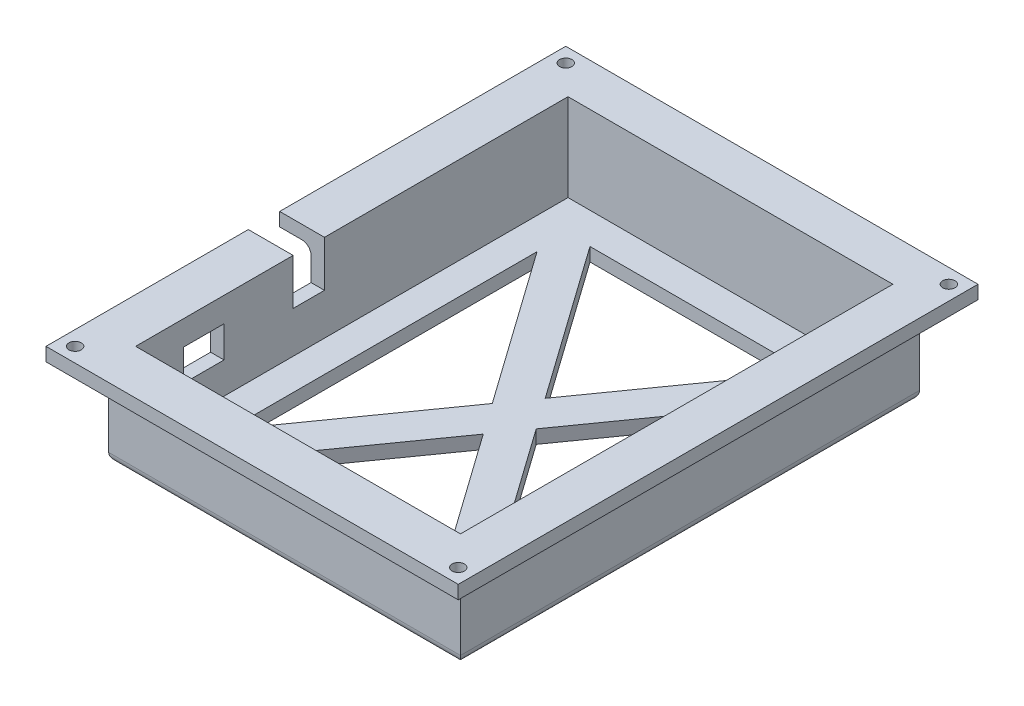
from build123d import *

# Parameters (mm, degrees)
SKETCH1_W              = 72.5
SKETCH1_H              = 96.5
BRACKETBASE_DEPTH      = 3
SKETCH3_W              = 78.5
SKETCH3_H              = 102.5
SKETCH3_W_2            = 72.5
SKETCH3_H_2            = 96.5
BRACKETWALLS_DEPTH     = 22.5
SKETCH4_W              = 7
SKETCH4_H              = 19.5
WIREHOLE_DEPTH         = 22.5
BRACKETFLANGE_DEPTH    = 3
SKETCH7_R              = 1.375
MOUNTINGHOLES_DEPTH    = 136.426179153
SKETCH8_W              = 9
SKETCH8_H              = 7
SWITCHHOLE_DEPTH       = 10
BOSS_EXTRUDE1_REACH    = 112.68
SKETCH10_W             = 2.5
SKETCH10_H             = 7
BOSS_EXTRUDE2_DEPTH    = 12.25
FILLET1_R              = 2
FILLET2_R              = 2
SKETCH11_W             = 7
SKETCH11_H             = 10.25
CUT_EXTRUDE1_DEPTH     = 10
WEIGHTREDUCTION1_DEPTH = 136.890580983


with BuildPart() as part:
    # Sketch1 → bracketBase (new body)
    with BuildSketch(Plane(origin=(0, 0, 0), x_dir=(1, 0, 0), z_dir=(0, 1, 0))):
        with Locations((36.25, 48.25)):
            Rectangle(SKETCH1_W, SKETCH1_H)
    extrude(amount=BRACKETBASE_DEPTH)

    # Sketch3 → bracketWalls (add)
    with BuildSketch(Plane.XZ):
        with Locations((36.25, -48.25)):
            Rectangle(SKETCH3_W, SKETCH3_H)
        with Locations((36.25, -48.25)):
            Rectangle(SKETCH3_W_2, SKETCH3_H_2, mode=Mode.SUBTRACT)
    extrude(amount=-BRACKETWALLS_DEPTH)

    # Sketch4 → wireHole (cut)
    with BuildSketch(Plane.ZY.offset(-72.5)):
        with Locations((-38.65, 12.75)):
            Rectangle(SKETCH4_W, SKETCH4_H)
    wirehole = extrude(amount=-WIREHOLE_DEPTH, mode=Mode.SUBTRACT)

    # Sketch6 → bracketFlange (add)
    with BuildSketch(Plane(origin=(0, 22.5, 0), x_dir=(1, 0, 0), z_dir=(0, 1, 0))):
        Polygon((72.5, 96.5), (72.5, 42.15), (82, 42.15), (82, 106), (-10, 106), (-10, -10), (82, -10), (82, 35.15), (72.5, 35.15), (72.5, 0), (0, 0), (0, 96.5), align=None)
    extrude(amount=-BRACKETFLANGE_DEPTH)

    # Sketch7 → mountingHoles (cut, through all)
    with BuildSketch(Plane.XZ.offset(-19.5)):
        with Locations((78.75, -102.75)):
            Circle(SKETCH7_R)
        with Locations((78.75, 6.75)):
            Circle(SKETCH7_R)
        with Locations((-6.75, -102.75)):
            Circle(SKETCH7_R)
        with Locations((-6.75, 6.75)):
            Circle(SKETCH7_R)
    extrude(amount=-MOUNTINGHOLES_DEPTH, mode=Mode.SUBTRACT)

    # Mirror1: wireHole across plane
    add(wirehole.mirror(Plane(origin=(36, 0, 0), x_dir=(0, 0, 1), z_dir=(1, 0, 0))), mode=Mode.SUBTRACT)

    # Sketch8 → switchHole (cut)
    with BuildSketch(Plane.ZY.offset(3)):
        with Locations((-15.23, 13.5)):
            Rectangle(SKETCH8_W, SKETCH8_H)
    extrude(amount=-SWITCHHOLE_DEPTH, mode=Mode.SUBTRACT)

    # Sketch9 → Boss-Extrude1 (add, up to next)
    with BuildSketch(Plane(origin=(0, 0, -35.15), x_dir=(-1, 0, 0), z_dir=(0, 0, -1)), mode=Mode.PRIVATE) as boss_extrude1_sk1:
        Polygon((-72.5, 3), (-72.5, 22.5), (-82, 22.5), (-82, 19.5), (-75.5, 19.5), (-75.5, 3), align=None)
    boss_extrude1_tool1 = extrude(boss_extrude1_sk1.sketch, amount=BOSS_EXTRUDE1_REACH, mode=Mode.PRIVATE) - part.part
    add(boss_extrude1_tool1.solids().sort_by_distance((75.1875, 14.8125, -35.15))[0])

    # Sketch10 → Boss-Extrude2 (add)
    with BuildSketch(Plane.XZ):
        with Locations((-1.75, -38.65)):
            Rectangle(SKETCH10_W, SKETCH10_H)
    extrude(amount=-BOSS_EXTRUDE2_DEPTH)

    # Fillet1
    fillet1_edges = [part.edges().sort_by_distance(p)[0] for p in [
        (-3, 19.5, -70.825),
        (36.25, 19.5, -99.5),
        (75.5, 19.5, -48.25),
        (36.25, 19.5, 3),
        (-3, 19.5, -16.075),
    ]]
    fillet(fillet1_edges, radius=FILLET1_R)

    # Fillet2
    fillet2_edges = [part.edges().sort_by_distance(p)[0] for p in [
        (36.25, 0, 3),
        (75.5, 0, -48.25),
        (36.25, 0, -99.5),
        (-3, 0, -48.25),
    ]]
    fillet(fillet2_edges, radius=FILLET2_R)

    # Sketch11 → Cut-Extrude1 (cut)
    with BuildSketch(Plane.ZY.offset(0.5)):
        with Locations((-38.65, 17.375)):
            Rectangle(SKETCH11_W, SKETCH11_H)
    extrude(amount=-CUT_EXTRUDE1_DEPTH, mode=Mode.SUBTRACT)

    # Sketch12 → weightReduction1 (cut, through all)
    with BuildSketch(Plane.XZ):
        Polygon((11.903565914, -89.5), (36.25, -55.165285264), (60.596434086, -89.5), align=None)
        Polygon((65.5, -82.584714736), (41.153565914, -48.25), (65.5, -13.915285264), align=None)
        Polygon((60.596434086, -7), (11.903565914, -7), (36.25, -41.334714736), align=None)
        Polygon((7, -13.915285264), (7, -82.584714736), (31.346434086, -48.25), align=None)
    extrude(amount=-WEIGHTREDUCTION1_DEPTH, mode=Mode.SUBTRACT)


solid = part.part
